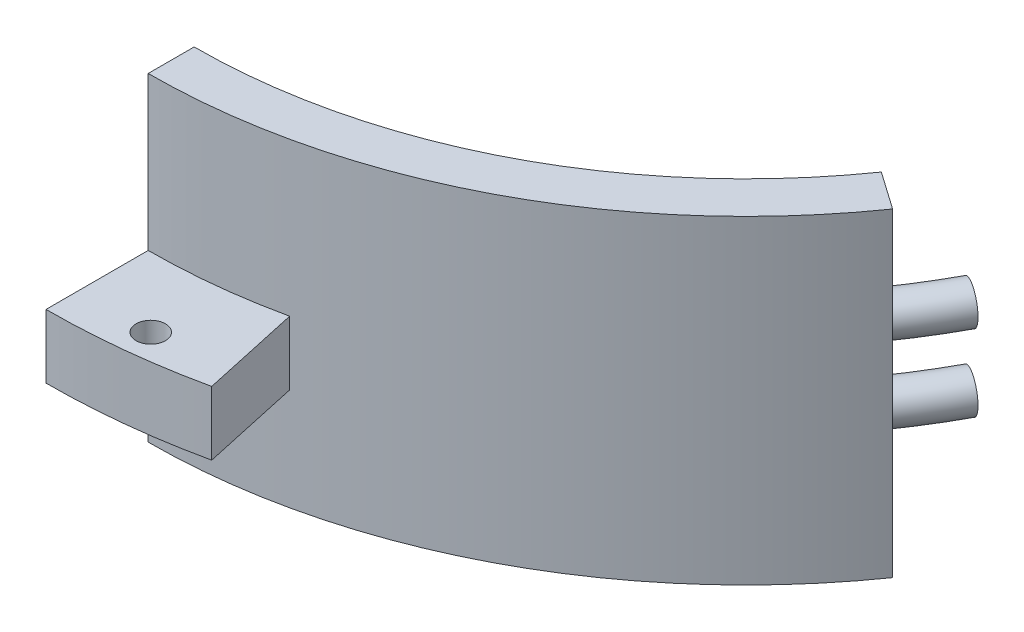
from build123d import *

# Parameters (mm, degrees)
BOSS_EXTRUDE1_DEPTH = 25
BOSS_EXTRUDE2_START = -19
BOSS_EXTRUDE2_DEPTH = 13
BOSS_EXTRUDE3_START = -17
BOSS_EXTRUDE3_DEPTH = 5
M2_HOLES_REACH      = 70.13
SKETCH5_R           = 1.15
CUT_EXTRUDE1_REACH  = 71.525
SKETCH7_R           = 1.5


with BuildPart() as part:
    # Sketch2 → Boss-Extrude1 (new body)
    with BuildSketch(Plane(origin=(0, 0, 0), x_dir=(1, 0, 0), z_dir=(0, 1, 0))):
        with BuildLine():
            Line((0, -43.2), (0, -46.8))
            ThreePointArc((0, -46.8), (21.609835099, -41.512106993), (38.336315673, -26.843377221))
            Line((38.336315673, -26.843377221), (35.387368313, -24.77850205))
            ThreePointArc((35.387368313, -24.77850205), (19.947540092, -38.318867993), (0, -43.2))
        make_face()
    extrude(amount=BOSS_EXTRUDE1_DEPTH)

    # Sketch3 → Boss-Extrude2 (add)
    with BuildSketch(Plane(origin=(0, 25, 0), x_dir=(1, 0, 0), z_dir=(0, 1, 0)).offset(BOSS_EXTRUDE2_START)):
        with BuildLine():
            Line((0, -40), (0, -43.2))
            ThreePointArc((0, -43.2), (19.947540092, -38.318867993), (35.387368313, -24.77850205))
            Line((35.387368313, -24.77850205), (32.766081772, -22.943057454))
            ThreePointArc((32.766081772, -22.943057454), (18.469944529, -35.480433327), (0, -40))
        make_face()
    extrude(amount=BOSS_EXTRUDE2_DEPTH)

    # Sketch4 → Boss-Extrude3 (add)
    with BuildSketch(Plane(origin=(0, 25, 0), x_dir=(1, 0, 0), z_dir=(0, 1, 0)).offset(BOSS_EXTRUDE3_START)):
        with BuildLine():
            ThreePointArc((10, -45.719142599), (5.029121512, -46.52900103), (0, -46.8))
            Line((0, -46.8), (0, -54.8))
            ThreePointArc((0, -54.8), (5.888800403, -54.482676419), (11.709401709, -53.53438065))
            Line((11.709401709, -53.53438065), (10, -45.719142599))
        make_face()
    extrude(amount=BOSS_EXTRUDE3_DEPTH)

    # Sketch5 → M2 holes (cut, up to next)
    with BuildSketch(Plane(origin=(0, 13, 0), x_dir=(1, 0, 0), z_dir=(0, 1, 0)), mode=Mode.PRIVATE) as m2_holes_sk1:
        with Locations((5.647015715, -52.245705216)):
            Circle(SKETCH5_R)
    m2_holes_tool1 = extrude(m2_holes_sk1.sketch, amount=-M2_HOLES_REACH, mode=Mode.PRIVATE) & part.part
    add(m2_holes_tool1.solids().sort_by_distance((5.647016, 13, 52.245705))[0], mode=Mode.SUBTRACT)

    # Sketch6 → Cut-Extrude1 (cut, up to next)
    with BuildSketch(Plane(origin=(0, 19, 0), x_dir=(1, 0, 0), z_dir=(0, 1, 0)), mode=Mode.PRIVATE) as cut_extrude1_sk1:
        with BuildLine():
            Line((0, -40), (0, -43))
            Line((0, -43), (5, -39.686269666))
            ThreePointArc((5, -39.686269666), (2.504916502, -39.921490369), (0, -40))
        make_face()
    cut_extrude1_tool1 = extrude(cut_extrude1_sk1.sketch, amount=-CUT_EXTRUDE1_REACH, mode=Mode.PRIVATE) & part.part
    add(cut_extrude1_tool1.solids().sort_by_distance((1.636399, 19, 40.932418))[0], mode=Mode.SUBTRACT)

    # Sweep1: sweep along a path in Sketch9
    with BuildLine(Plane(origin=(0, 25, 0), x_dir=(1, 0, 0), z_dir=(0, 1, 0))) as sweep1_path:
        ThreePointArc((35.387368313, -24.77850205), (36.762003919, -22.689095792), (38.013421067, -20.523640486))
    # Sketch7 → Sweep1 (sweep)
    with BuildSketch(Plane(origin=(0, 0, 0), x_dir=(-0.8191520442889931, 0, -0.5735764363510442), z_dir=(0.5735764363510442, 0, -0.8191520442889931))):
        with Locations((-43.4, 15.5)):
            Circle(SKETCH7_R)
        with Locations((-43.4, 9.5)):
            Circle(SKETCH7_R)
    sweep(path=sweep1_path.line)


solid = part.part
